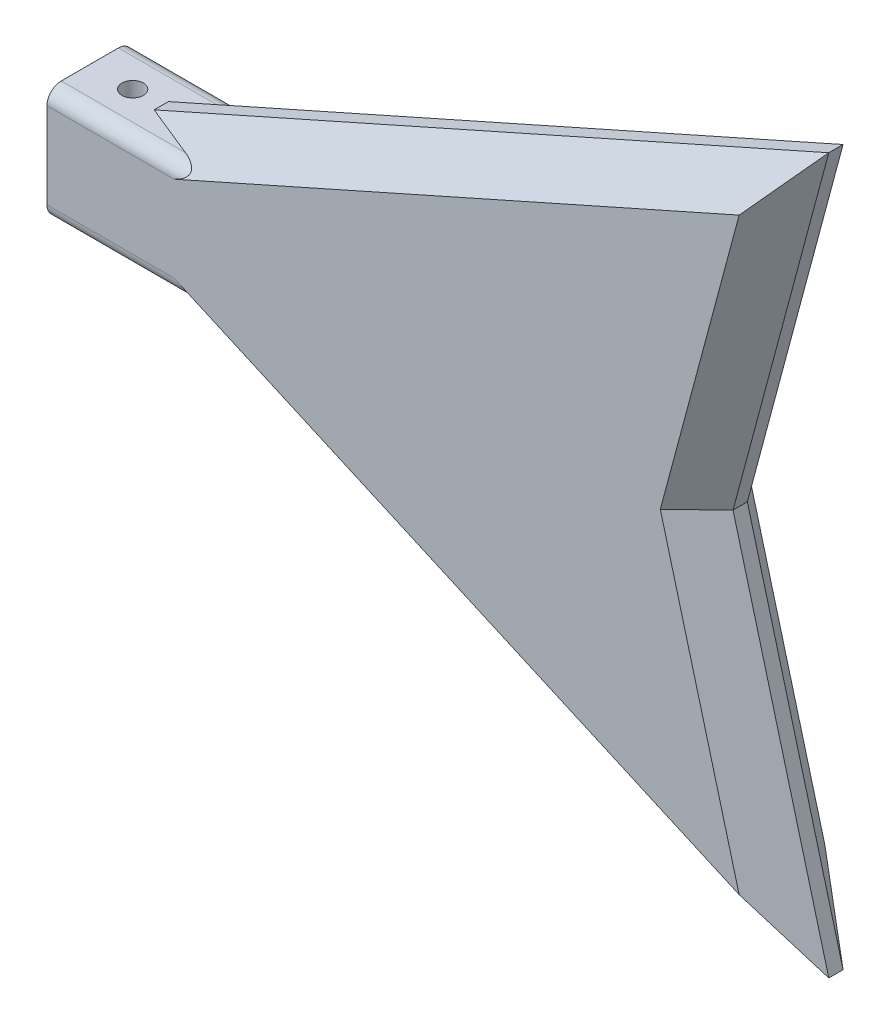
from build123d import *

# Parameters (mm, degrees)
BOSS_EXTRUDE8_DEPTH = 6
SKETCH7_R           = 5
CUT_EXTRUDE3_DEPTH  = 14
SKETCH8_R           = 1.5
CUT_EXTRUDE4_DEPTH  = 120.57771354
CHAMFER3_SIZE       = 5
FILLET4_R           = 2


with BuildPart() as part:
    # Sketch1 → Boss-Extrude8 (new, symmetric)
    with BuildSketch(Plane.XY):
        Polygon((10, -8), (104.397459622, -50), (91, 0), (104.397459622, 50), (10, 8), (0, 8), (0, -8), align=None)
    extrude(amount=BOSS_EXTRUDE8_DEPTH, both=True)

    # Sketch7 → Cut-Extrude3 (cut)
    with BuildSketch(Plane.ZY):
        Circle(SKETCH7_R)
    extrude(amount=-CUT_EXTRUDE3_DEPTH, mode=Mode.SUBTRACT)

    # Sketch8 → Cut-Extrude4 (cut, through all)
    with BuildSketch(Plane(origin=(0, 8, 0), x_dir=(1, 0, 0), z_dir=(0, 1, 0))):
        with Locations((6, 0)):
            Circle(SKETCH8_R)
    extrude(amount=-CUT_EXTRUDE4_DEPTH, mode=Mode.SUBTRACT)

    # Chamfer3
    chamfer3_edges = [part.edges().sort_by_distance(p)[0] for p in [
        (57.198729811, -29, 6),
        (97.698729811, -25, 6),
        (97.698729811, 25, 6),
        (57.198729811, 29, 6),
        (57.198729811, -29, -6),
        (97.698729811, -25, -6),
        (97.698729811, 25, -6),
        (57.198729811, 29, -6),
    ]]
    chamfer(chamfer3_edges, length=CHAMFER3_SIZE)

    # Fillet4
    fillet4_edges = [part.edges().sort_by_distance(p)[0] for p in [
        (11.149959091, -8, 6),
        (11.149959091, -8, -6),
        (11.149959091, 8, -6),
        (11.149959091, 8, 6),
    ]]
    fillet(fillet4_edges, radius=FILLET4_R)


solid = part.part
